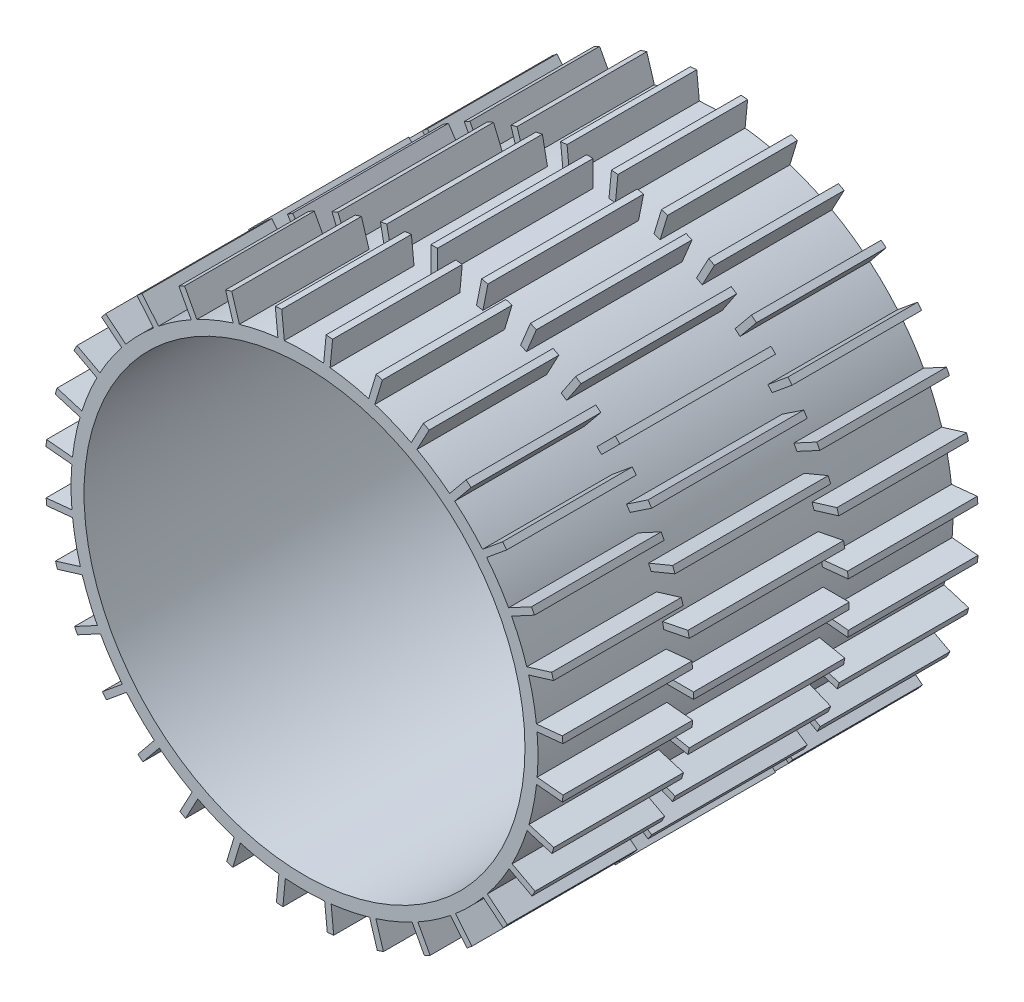
from build123d import *

# Parameters (mm, degrees)
BOSS_EXTRUDE1_DEPTH      = 38.1
BOSS_EXTRUDE1_DEPTH_BACK = 38.1
SKETCH1_R                = 107.95
SKETCH1_7_R              = 107.95
BOSS_EXTRUDE3_DEPTH      = 101.6
CUT_EXTRUDE1_DEPTH       = 38.1


with BuildPart() as part:
    # Sketch1 → Boss-Extrude1 (new, two sides: drawn at the far end of the back side and taken through both)
    with BuildSketch(Plane.XY.offset(-BOSS_EXTRUDE1_DEPTH_BACK)):
        with BuildLine():
            Line((-1.5875, 127), (-1.5875, 114.288975163))
            ThreePointArc((-1.5875, 114.288975163), (-11.20335914, 113.749614259), (-20.739676335, 112.402650438))
            Line((-20.739676335, 112.402650438), (-23.219474263, 124.869436497))
            Line((-23.219474263, 124.869436497), (-26.333467529, 124.250024725))
            Line((-26.333467529, 124.250024725), (-23.8536696, 111.783238666))
            ThreePointArc((-23.8536696, 111.783238666), (-33.17953861, 109.378280374), (-42.269838539, 106.196754893))
            Line((-42.269838539, 106.196754893), (-47.134137153, 117.940210578))
            Line((-47.134137153, 117.940210578), (-50.067454668, 116.72519068))
            Line((-50.067454668, 116.72519068), (-45.203156055, 104.981734996))
            ThreePointArc((-45.203156055, 104.981734996), (-53.880647019, 100.803600515), (-62.175594553, 95.909777614))
            Line((-62.175594553, 95.909777614), (-69.237461584, 106.478608507))
            Line((-69.237461584, 106.478608507), (-71.877377603, 104.714673018))
            Line((-71.877377603, 104.714673018), (-64.815510572, 94.145842124))
            ThreePointArc((-64.815510572, 94.145842124), (-72.51115238, 88.355094819), (-79.691977337, 81.937041368))
            Line((-79.691977337, 81.937041368), (-88.680029196, 90.925093226))
            Line((-88.680029196, 90.925093226), (-90.925093226, 88.680029196))
            Line((-90.925093226, 88.680029196), (-81.937041368, 79.691977337))
            ThreePointArc((-81.937041368, 79.691977337), (-88.355094819, 72.51115238), (-94.145842124, 64.815510572))
            Line((-94.145842124, 64.815510572), (-104.714673018, 71.877377603))
            Line((-104.714673018, 71.877377603), (-106.478608507, 69.237461584))
            Line((-106.478608507, 69.237461584), (-95.909777614, 62.175594553))
            ThreePointArc((-95.909777614, 62.175594553), (-100.803600515, 53.880647019), (-104.981734996, 45.203156055))
            Line((-104.981734996, 45.203156055), (-116.72519068, 50.067454668))
            Line((-116.72519068, 50.067454668), (-117.940210578, 47.134137153))
            Line((-117.940210578, 47.134137153), (-106.196754893, 42.269838539))
            ThreePointArc((-106.196754893, 42.269838539), (-109.378280374, 33.17953861), (-111.783238666, 23.8536696))
            Line((-111.783238666, 23.8536696), (-124.250024725, 26.333467529))
            Line((-124.250024725, 26.333467529), (-124.869436497, 23.219474263))
            Line((-124.869436497, 23.219474263), (-112.402650438, 20.739676335))
            ThreePointArc((-112.402650438, 20.739676335), (-113.749614259, 11.20335914), (-114.288975163, 1.5875))
            Line((-114.288975163, 1.5875), (-127, 1.5875))
            Line((-127, 1.5875), (-127, -1.5875))
            Line((-127, -1.5875), (-114.288975163, -1.5875))
            ThreePointArc((-114.288975163, -1.5875), (-113.749614259, -11.20335914), (-112.402650438, -20.739676335))
            Line((-112.402650438, -20.739676335), (-124.869436497, -23.219474263))
            Line((-124.869436497, -23.219474263), (-124.250024725, -26.333467529))
            Line((-124.250024725, -26.333467529), (-111.783238666, -23.8536696))
            ThreePointArc((-111.783238666, -23.8536696), (-109.378280374, -33.17953861), (-106.196754893, -42.269838539))
            Line((-106.196754893, -42.269838539), (-117.940210578, -47.134137153))
            Line((-117.940210578, -47.134137153), (-116.72519068, -50.067454668))
            Line((-116.72519068, -50.067454668), (-104.981734996, -45.203156055))
            ThreePointArc((-104.981734996, -45.203156055), (-100.803600515, -53.880647019), (-95.909777614, -62.175594553))
            Line((-95.909777614, -62.175594553), (-106.478608507, -69.237461584))
            Line((-106.478608507, -69.237461584), (-104.714673018, -71.877377603))
            Line((-104.714673018, -71.877377603), (-94.145842124, -64.815510572))
            ThreePointArc((-94.145842124, -64.815510572), (-88.355094819, -72.51115238), (-81.937041368, -79.691977337))
            Line((-81.937041368, -79.691977337), (-90.925093226, -88.680029196))
            Line((-90.925093226, -88.680029196), (-88.680029196, -90.925093226))
            Line((-88.680029196, -90.925093226), (-79.691977337, -81.937041368))
            ThreePointArc((-79.691977337, -81.937041368), (-72.51115238, -88.355094819), (-64.815510572, -94.145842124))
            Line((-64.815510572, -94.145842124), (-71.877377603, -104.714673018))
            Line((-71.877377603, -104.714673018), (-69.237461584, -106.478608507))
            Line((-69.237461584, -106.478608507), (-62.175594553, -95.909777614))
            ThreePointArc((-62.175594553, -95.909777614), (-53.880647019, -100.803600515), (-45.203156055, -104.981734996))
            Line((-45.203156055, -104.981734996), (-50.067454668, -116.72519068))
            Line((-50.067454668, -116.72519068), (-47.134137153, -117.940210578))
            Line((-47.134137153, -117.940210578), (-42.269838539, -106.196754893))
            ThreePointArc((-42.269838539, -106.196754893), (-33.17953861, -109.378280374), (-23.8536696, -111.783238666))
            Line((-23.8536696, -111.783238666), (-26.333467529, -124.250024725))
            Line((-26.333467529, -124.250024725), (-23.219474263, -124.869436497))
            Line((-23.219474263, -124.869436497), (-20.739676335, -112.402650438))
            ThreePointArc((-20.739676335, -112.402650438), (-11.20335914, -113.749614259), (-1.5875, -114.288975163))
            Line((-1.5875, -114.288975163), (-1.5875, -127))
            Line((-1.5875, -127), (1.5875, -127))
            Line((1.5875, -127), (1.5875, -114.288975163))
            ThreePointArc((1.5875, -114.288975163), (11.20335914, -113.749614259), (20.739676335, -112.402650438))
            Line((20.739676335, -112.402650438), (23.219474263, -124.869436497))
            Line((23.219474263, -124.869436497), (26.333467529, -124.250024725))
            Line((26.333467529, -124.250024725), (23.8536696, -111.783238666))
            ThreePointArc((23.8536696, -111.783238666), (33.17953861, -109.378280374), (42.269838539, -106.196754893))
            Line((42.269838539, -106.196754893), (47.134137153, -117.940210578))
            Line((47.134137153, -117.940210578), (50.067454668, -116.72519068))
            Line((50.067454668, -116.72519068), (45.203156055, -104.981734996))
            ThreePointArc((45.203156055, -104.981734996), (53.880647019, -100.803600515), (62.175594553, -95.909777614))
            Line((62.175594553, -95.909777614), (69.237461584, -106.478608507))
            Line((69.237461584, -106.478608507), (71.877377603, -104.714673018))
            Line((71.877377603, -104.714673018), (64.815510572, -94.145842124))
            ThreePointArc((64.815510572, -94.145842124), (72.51115238, -88.355094819), (79.691977337, -81.937041368))
            Line((79.691977337, -81.937041368), (88.680029196, -90.925093226))
            Line((88.680029196, -90.925093226), (90.925093226, -88.680029196))
            Line((90.925093226, -88.680029196), (81.937041368, -79.691977337))
            ThreePointArc((81.937041368, -79.691977337), (88.355094819, -72.51115238), (94.145842124, -64.815510572))
            Line((94.145842124, -64.815510572), (104.714673018, -71.877377603))
            Line((104.714673018, -71.877377603), (106.478608507, -69.237461584))
            Line((106.478608507, -69.237461584), (95.909777614, -62.175594553))
            ThreePointArc((95.909777614, -62.175594553), (100.803600515, -53.880647019), (104.981734996, -45.203156055))
            Line((104.981734996, -45.203156055), (116.72519068, -50.067454668))
            Line((116.72519068, -50.067454668), (117.940210578, -47.134137153))
            Line((117.940210578, -47.134137153), (106.196754893, -42.269838539))
            ThreePointArc((106.196754893, -42.269838539), (109.378280374, -33.17953861), (111.783238666, -23.8536696))
            Line((111.783238666, -23.8536696), (124.250024725, -26.333467529))
            Line((124.250024725, -26.333467529), (124.869436497, -23.219474263))
            Line((124.869436497, -23.219474263), (112.402650438, -20.739676335))
            ThreePointArc((112.402650438, -20.739676335), (113.749614259, -11.20335914), (114.288975163, -1.5875))
            Line((114.288975163, -1.5875), (127, -1.5875))
            Line((127, -1.5875), (127, 1.5875))
            Line((127, 1.5875), (114.288975163, 1.5875))
            ThreePointArc((114.288975163, 1.5875), (113.749614259, 11.20335914), (112.402650438, 20.739676335))
            Line((112.402650438, 20.739676335), (124.869436497, 23.219474263))
            Line((124.869436497, 23.219474263), (124.250024725, 26.333467529))
            Line((124.250024725, 26.333467529), (111.783238666, 23.8536696))
            ThreePointArc((111.783238666, 23.8536696), (109.378280374, 33.17953861), (106.196754893, 42.269838539))
            Line((106.196754893, 42.269838539), (117.940210578, 47.134137153))
            Line((117.940210578, 47.134137153), (116.72519068, 50.067454668))
            Line((116.72519068, 50.067454668), (104.981734996, 45.203156055))
            ThreePointArc((104.981734996, 45.203156055), (100.803600515, 53.880647019), (95.909777614, 62.175594553))
            Line((95.909777614, 62.175594553), (106.478608507, 69.237461584))
            Line((106.478608507, 69.237461584), (104.714673018, 71.877377603))
            Line((104.714673018, 71.877377603), (94.145842124, 64.815510572))
            ThreePointArc((94.145842124, 64.815510572), (88.355094819, 72.51115238), (81.937041368, 79.691977337))
            Line((81.937041368, 79.691977337), (90.925093226, 88.680029196))
            Line((90.925093226, 88.680029196), (88.680029196, 90.925093226))
            Line((88.680029196, 90.925093226), (79.691977337, 81.937041368))
            ThreePointArc((79.691977337, 81.937041368), (72.51115238, 88.355094819), (64.815510572, 94.145842124))
            Line((64.815510572, 94.145842124), (71.877377603, 104.714673018))
            Line((71.877377603, 104.714673018), (69.237461584, 106.478608507))
            Line((69.237461584, 106.478608507), (62.175594553, 95.909777614))
            ThreePointArc((62.175594553, 95.909777614), (53.880647019, 100.803600515), (45.203156055, 104.981734996))
            Line((45.203156055, 104.981734996), (50.067454668, 116.72519068))
            Line((50.067454668, 116.72519068), (47.134137153, 117.940210578))
            Line((47.134137153, 117.940210578), (42.269838539, 106.196754893))
            ThreePointArc((42.269838539, 106.196754893), (33.17953861, 109.378280374), (23.8536696, 111.783238666))
            Line((23.8536696, 111.783238666), (26.333467529, 124.250024725))
            Line((26.333467529, 124.250024725), (23.219474263, 124.869436497))
            Line((23.219474263, 124.869436497), (20.739676335, 112.402650438))
            ThreePointArc((20.739676335, 112.402650438), (11.20335914, 113.749614259), (1.5875, 114.288975163))
            Line((1.5875, 114.288975163), (1.5875, 127))
            Line((1.5875, 127), (-1.5875, 127))
        make_face()
        Circle(SKETCH1_R, mode=Mode.SUBTRACT)
    extrude(amount=BOSS_EXTRUDE1_DEPTH + BOSS_EXTRUDE1_DEPTH_BACK)

    # Sketch1<7> → Boss-Extrude3 (add, symmetric)
    with BuildSketch(Plane.XY):
        with BuildLine():
            Line((-9.870878362, 113.872980818), (-11.144371302, 126.520050366))
            Line((-11.144371302, 126.520050366), (-14.303396347, 126.20195327))
            Line((-14.303396347, 126.20195327), (-13.029903408, 113.554883722))
            ThreePointArc((-13.029903408, 113.554883722), (-22.543343004, 112.054842315), (-31.896728699, 109.759230584))
            Line((-31.896728699, 109.759230584), (-35.6130727, 121.914844089))
            Line((-35.6130727, 121.914844089), (-38.6493403, 120.986563926))
            Line((-38.6493403, 120.986563926), (-34.932996299, 108.830950421))
            ThreePointArc((-34.932996299, 108.830950421), (-43.97099426, 105.503751894), (-52.69680564, 101.427494672))
            Line((-52.69680564, 101.427494672), (-58.713183686, 112.624518724))
            Line((-58.713183686, 112.624518724), (-61.510011779, 111.12172878))
            Line((-61.510011779, 111.12172878), (-55.493633734, 99.924704728))
            ThreePointArc((-55.493633734, 99.924704728), (-63.708864866, 94.898211456), (-71.471773893, 89.19795702))
            Line((-71.471773893, 89.19795702), (-79.556979949, 99.006096265))
            Line((-79.556979949, 99.006096265), (-82.006888001, 96.986547916))
            Line((-82.006888001, 96.986547916), (-73.921681945, 87.178408671))
            ThreePointArc((-73.921681945, 87.178408671), (-80.998439524, 80.64578597), (-87.500121957, 73.540591904))
            Line((-87.500121957, 73.540591904), (-97.343446089, 81.58292505))
            Line((-97.343446089, 81.58292505), (-99.352285508, 79.124228405))
            Line((-99.352285508, 79.124228405), (-89.508961375, 71.081895259))
            ThreePointArc((-89.508961375, 71.081895259), (-95.175289575, 63.294188157), (-100.165889404, 55.057103083))
            Line((-100.165889404, 55.057103083), (-111.389058187, 61.024567777))
            Line((-111.389058187, 61.024567777), (-112.879630399, 58.22120917))
            Line((-112.879630399, 58.22120917), (-101.656461616, 52.253744475))
            ThreePointArc((-101.656461616, 52.253744475), (-105.694606622, 43.510230188), (-108.982337896, 34.457800666))
            Line((-108.982337896, 34.457800666), (-121.154051247, 38.121070588))
            Line((-121.154051247, 38.121070588), (-122.069074398, 35.080781518))
            Line((-122.069074398, 35.080781518), (-109.897361047, 31.417511595))
            ThreePointArc((-109.897361047, 31.417511595), (-112.152139211, 22.054198474), (-113.61065626, 12.534304294))
            Line((-113.61065626, 12.534304294), (-126.263162061, 13.752602035))
            Line((-126.263162061, 13.752602035), (-126.567472325, 10.592219105))
            Line((-126.567472325, 10.592219105), (-113.914966524, 9.373921364))
            ThreePointArc((-113.914966524, 9.373921364), (-114.299727986, -0.249363719), (-113.872980818, -9.870878362))
            Line((-113.872980818, -9.870878362), (-126.520050366, -11.144371302))
            Line((-126.520050366, -11.144371302), (-126.20195327, -14.303396347))
            Line((-126.20195327, -14.303396347), (-113.554883722, -13.029903408))
            ThreePointArc((-113.554883722, -13.029903408), (-112.054842315, -22.543343004), (-109.759230584, -31.896728699))
            Line((-109.759230584, -31.896728699), (-121.914844089, -35.6130727))
            Line((-121.914844089, -35.6130727), (-120.986563926, -38.6493403))
            Line((-120.986563926, -38.6493403), (-108.830950421, -34.932996299))
            ThreePointArc((-108.830950421, -34.932996299), (-105.503751894, -43.97099426), (-101.427494672, -52.69680564))
            Line((-101.427494672, -52.69680564), (-112.624518724, -58.713183686))
            Line((-112.624518724, -58.713183686), (-111.12172878, -61.510011779))
            Line((-111.12172878, -61.510011779), (-99.924704728, -55.493633734))
            ThreePointArc((-99.924704728, -55.493633734), (-94.898211456, -63.708864866), (-89.19795702, -71.471773893))
            Line((-89.19795702, -71.471773893), (-99.006096265, -79.556979949))
            Line((-99.006096265, -79.556979949), (-96.986547916, -82.006888001))
            Line((-96.986547916, -82.006888001), (-87.178408671, -73.921681945))
            ThreePointArc((-87.178408671, -73.921681945), (-80.64578597, -80.998439524), (-73.540591904, -87.500121957))
            Line((-73.540591904, -87.500121957), (-81.58292505, -97.343446089))
            Line((-81.58292505, -97.343446089), (-79.124228405, -99.352285508))
            Line((-79.124228405, -99.352285508), (-71.081895259, -89.508961375))
            ThreePointArc((-71.081895259, -89.508961375), (-63.294188157, -95.175289575), (-55.057103083, -100.165889404))
            Line((-55.057103083, -100.165889404), (-61.024567777, -111.389058187))
            Line((-61.024567777, -111.389058187), (-58.22120917, -112.879630399))
            Line((-58.22120917, -112.879630399), (-52.253744475, -101.656461616))
            ThreePointArc((-52.253744475, -101.656461616), (-43.510230188, -105.694606622), (-34.457800666, -108.982337896))
            Line((-34.457800666, -108.982337896), (-38.121070588, -121.154051247))
            Line((-38.121070588, -121.154051247), (-35.080781518, -122.069074398))
            Line((-35.080781518, -122.069074398), (-31.417511595, -109.897361047))
            ThreePointArc((-31.417511595, -109.897361047), (-22.054198474, -112.152139211), (-12.534304294, -113.61065626))
            Line((-12.534304294, -113.61065626), (-13.752602035, -126.263162061))
            Line((-13.752602035, -126.263162061), (-10.592219105, -126.567472325))
            Line((-10.592219105, -126.567472325), (-9.373921364, -113.914966524))
            ThreePointArc((-9.373921364, -113.914966524), (0.249363719, -114.299727986), (9.870878362, -113.872980818))
            Line((9.870878362, -113.872980818), (11.144371302, -126.520050366))
            Line((11.144371302, -126.520050366), (14.303396347, -126.20195327))
            Line((14.303396347, -126.20195327), (13.029903408, -113.554883722))
            ThreePointArc((13.029903408, -113.554883722), (22.543343004, -112.054842315), (31.896728699, -109.759230584))
            Line((31.896728699, -109.759230584), (35.6130727, -121.914844089))
            Line((35.6130727, -121.914844089), (38.6493403, -120.986563926))
            Line((38.6493403, -120.986563926), (34.932996299, -108.830950421))
            ThreePointArc((34.932996299, -108.830950421), (43.97099426, -105.503751894), (52.69680564, -101.427494672))
            Line((52.69680564, -101.427494672), (58.713183686, -112.624518724))
            Line((58.713183686, -112.624518724), (61.510011779, -111.12172878))
            Line((61.510011779, -111.12172878), (55.493633734, -99.924704728))
            ThreePointArc((55.493633734, -99.924704728), (63.708864866, -94.898211456), (71.471773893, -89.19795702))
            Line((71.471773893, -89.19795702), (79.556979949, -99.006096265))
            Line((79.556979949, -99.006096265), (82.006888001, -96.986547916))
            Line((82.006888001, -96.986547916), (73.921681945, -87.178408671))
            ThreePointArc((73.921681945, -87.178408671), (80.998439524, -80.64578597), (87.500121957, -73.540591904))
            Line((87.500121957, -73.540591904), (97.343446089, -81.58292505))
            Line((97.343446089, -81.58292505), (99.352285508, -79.124228405))
            Line((99.352285508, -79.124228405), (89.508961375, -71.081895259))
            ThreePointArc((89.508961375, -71.081895259), (95.175289575, -63.294188157), (100.165889404, -55.057103083))
            Line((100.165889404, -55.057103083), (111.389058187, -61.024567777))
            Line((111.389058187, -61.024567777), (112.879630399, -58.22120917))
            Line((112.879630399, -58.22120917), (101.656461616, -52.253744475))
            ThreePointArc((101.656461616, -52.253744475), (105.694606622, -43.510230188), (108.982337896, -34.457800666))
            Line((108.982337896, -34.457800666), (121.154051247, -38.121070588))
            Line((121.154051247, -38.121070588), (122.069074398, -35.080781518))
            Line((122.069074398, -35.080781518), (109.897361047, -31.417511595))
            ThreePointArc((109.897361047, -31.417511595), (112.152139211, -22.054198474), (113.61065626, -12.534304294))
            Line((113.61065626, -12.534304294), (126.263162061, -13.752602035))
            Line((126.263162061, -13.752602035), (126.567472325, -10.592219105))
            Line((126.567472325, -10.592219105), (113.914966524, -9.373921364))
            ThreePointArc((113.914966524, -9.373921364), (114.299727986, 0.249363719), (113.872980818, 9.870878362))
            Line((113.872980818, 9.870878362), (126.520050366, 11.144371302))
            Line((126.520050366, 11.144371302), (126.20195327, 14.303396347))
            Line((126.20195327, 14.303396347), (113.554883722, 13.029903408))
            ThreePointArc((113.554883722, 13.029903408), (112.054842315, 22.543343004), (109.759230584, 31.896728699))
            Line((109.759230584, 31.896728699), (121.914844089, 35.6130727))
            Line((121.914844089, 35.6130727), (120.986563926, 38.6493403))
            Line((120.986563926, 38.6493403), (108.830950421, 34.932996299))
            ThreePointArc((108.830950421, 34.932996299), (105.503751894, 43.97099426), (101.427494672, 52.69680564))
            Line((101.427494672, 52.69680564), (112.624518724, 58.713183686))
            Line((112.624518724, 58.713183686), (111.12172878, 61.510011779))
            Line((111.12172878, 61.510011779), (99.924704728, 55.493633734))
            ThreePointArc((99.924704728, 55.493633734), (94.898211456, 63.708864866), (89.19795702, 71.471773893))
            Line((89.19795702, 71.471773893), (99.006096265, 79.556979949))
            Line((99.006096265, 79.556979949), (96.986547916, 82.006888001))
            Line((96.986547916, 82.006888001), (87.178408671, 73.921681945))
            ThreePointArc((87.178408671, 73.921681945), (80.64578597, 80.998439524), (73.540591904, 87.500121957))
            Line((73.540591904, 87.500121957), (81.58292505, 97.343446089))
            Line((81.58292505, 97.343446089), (79.124228405, 99.352285508))
            Line((79.124228405, 99.352285508), (71.081895259, 89.508961375))
            ThreePointArc((71.081895259, 89.508961375), (63.294188157, 95.175289575), (55.057103083, 100.165889404))
            Line((55.057103083, 100.165889404), (61.024567777, 111.389058187))
            Line((61.024567777, 111.389058187), (58.22120917, 112.879630399))
            Line((58.22120917, 112.879630399), (52.253744475, 101.656461616))
            ThreePointArc((52.253744475, 101.656461616), (43.510230188, 105.694606622), (34.457800666, 108.982337896))
            Line((34.457800666, 108.982337896), (38.121070588, 121.154051247))
            Line((38.121070588, 121.154051247), (35.080781518, 122.069074398))
            Line((35.080781518, 122.069074398), (31.417511595, 109.897361047))
            ThreePointArc((31.417511595, 109.897361047), (22.054198474, 112.152139211), (12.534304294, 113.61065626))
            Line((12.534304294, 113.61065626), (13.752602035, 126.263162061))
            Line((13.752602035, 126.263162061), (10.592219105, 126.567472325))
            Line((10.592219105, 126.567472325), (9.373921364, 113.914966524))
            ThreePointArc((9.373921364, 113.914966524), (-0.249363719, 114.299727986), (-9.870878362, 113.872980818))
        make_face()
        Circle(SKETCH1_7_R, mode=Mode.SUBTRACT)
    extrude(amount=BOSS_EXTRUDE3_DEPTH, both=True)

    # Sketch1<11> → Cut-Extrude1 (cut, symmetric)
    with BuildSketch(Plane.XY):
        with BuildLine():
            Line((10.592219105, 126.567472325), (9.373921364, 113.914966524))
            ThreePointArc((9.373921364, 113.914966524), (10.955169513, 113.773785473), (12.534304294, 113.61065626))
            Line((12.534304294, 113.61065626), (13.752602035, 126.263162061))
            Line((13.752602035, 126.263162061), (10.592219105, 126.567472325))
        make_face()
        with BuildLine():
            ThreePointArc((-13.029903408, 113.554883722), (-11.451495442, 113.724901636), (-9.870878362, 113.872980818))
            Line((-9.870878362, 113.872980818), (-11.144371302, 126.520050366))
            Line((-11.144371302, 126.520050366), (-14.303396347, 126.20195327))
            Line((-14.303396347, 126.20195327), (-13.029903408, 113.554883722))
        make_face()
        with BuildLine():
            Line((35.080781518, 122.069074398), (31.417511595, 109.897361047))
            ThreePointArc((31.417511595, 109.897361047), (32.940833448, 109.45040654), (34.457800666, 108.982337896))
            Line((34.457800666, 108.982337896), (38.121070588, 121.154051247))
            Line((38.121070588, 121.154051247), (35.080781518, 122.069074398))
        make_face()
        with BuildLine():
            ThreePointArc((-34.932996299, 108.830950421), (-33.41808585, 109.305633607), (-31.896728699, 109.759230584))
            Line((-31.896728699, 109.759230584), (-35.6130727, 121.914844089))
            Line((-35.6130727, 121.914844089), (-38.6493403, 120.986563926))
            Line((-38.6493403, 120.986563926), (-34.932996299, 108.830950421))
        make_face()
        with BuildLine():
            Line((58.22120917, 112.879630399), (52.253744475, 101.656461616))
            ThreePointArc((52.253744475, 101.656461616), (53.660599626, 100.920909864), (55.057103083, 100.165889404))
            Line((55.057103083, 100.165889404), (61.024567777, 111.389058187))
            Line((61.024567777, 111.389058187), (58.22120917, 112.879630399))
        make_face()
        with BuildLine():
            ThreePointArc((-55.493633734, 99.924704728), (-54.100437959, 100.685811377), (-52.69680564, 101.427494672))
            Line((-52.69680564, 101.427494672), (-58.713183686, 112.624518724))
            Line((-58.713183686, 112.624518724), (-61.510011779, 111.12172878))
            Line((-61.510011779, 111.12172878), (-55.493633734, 99.924704728))
        make_face()
        with BuildLine():
            Line((79.124228405, 99.352285508), (71.081895259, 89.508961375))
            ThreePointArc((71.081895259, 89.508961375), (72.318219055, 88.513079219), (73.540591904, 87.500121957))
            Line((73.540591904, 87.500121957), (81.58292505, 97.343446089))
            Line((81.58292505, 97.343446089), (79.124228405, 99.352285508))
        make_face()
        with BuildLine():
            ThreePointArc((-73.921681945, 87.178408671), (-72.703740578, 88.196689881), (-71.471773893, 89.19795702))
            Line((-71.471773893, 89.19795702), (-79.556979949, 99.006096265))
            Line((-79.556979949, 99.006096265), (-82.006888001, 96.986547916))
            Line((-82.006888001, 96.986547916), (-73.921681945, 87.178408671))
        make_face()
        with BuildLine():
            Line((96.986547916, 82.006888001), (87.178408671, 73.921681945))
            ThreePointArc((87.178408671, 73.921681945), (88.196689881, 72.703740578), (89.19795702, 71.471773893))
            Line((89.19795702, 71.471773893), (99.006096265, 79.556979949))
            Line((99.006096265, 79.556979949), (96.986547916, 82.006888001))
        make_face()
        with BuildLine():
            ThreePointArc((-89.508961375, 71.081895259), (-88.513079219, 72.318219055), (-87.500121957, 73.540591904))
            Line((-87.500121957, 73.540591904), (-97.343446089, 81.58292505))
            Line((-97.343446089, 81.58292505), (-99.352285508, 79.124228405))
            Line((-99.352285508, 79.124228405), (-89.508961375, 71.081895259))
        make_face()
        with BuildLine():
            Line((111.12172878, 61.510011779), (99.924704728, 55.493633734))
            ThreePointArc((99.924704728, 55.493633734), (100.685811377, 54.100437959), (101.427494672, 52.69680564))
            Line((101.427494672, 52.69680564), (112.624518724, 58.713183686))
            Line((112.624518724, 58.713183686), (111.12172878, 61.510011779))
        make_face()
        with BuildLine():
            ThreePointArc((-101.656461616, 52.253744475), (-100.920909864, 53.660599626), (-100.165889404, 55.057103083))
            Line((-100.165889404, 55.057103083), (-111.389058187, 61.024567777))
            Line((-111.389058187, 61.024567777), (-112.879630399, 58.22120917))
            Line((-112.879630399, 58.22120917), (-101.656461616, 52.253744475))
        make_face()
        with BuildLine():
            Line((120.986563926, 38.6493403), (108.830950421, 34.932996299))
            ThreePointArc((108.830950421, 34.932996299), (109.305633607, 33.41808585), (109.759230584, 31.896728699))
            Line((109.759230584, 31.896728699), (121.914844089, 35.6130727))
            Line((121.914844089, 35.6130727), (120.986563926, 38.6493403))
        make_face()
        with BuildLine():
            ThreePointArc((-109.897361047, 31.417511595), (-109.45040654, 32.940833448), (-108.982337896, 34.457800666))
            Line((-108.982337896, 34.457800666), (-121.154051247, 38.121070588))
            Line((-121.154051247, 38.121070588), (-122.069074398, 35.080781518))
            Line((-122.069074398, 35.080781518), (-109.897361047, 31.417511595))
        make_face()
        with BuildLine():
            Line((126.20195327, 14.303396347), (113.554883722, 13.029903408))
            ThreePointArc((113.554883722, 13.029903408), (113.724901636, 11.451495442), (113.872980818, 9.870878362))
            Line((113.872980818, 9.870878362), (126.520050366, 11.144371302))
            Line((126.520050366, 11.144371302), (126.20195327, 14.303396347))
        make_face()
        with BuildLine():
            ThreePointArc((-113.914966524, 9.373921364), (-113.773785473, 10.955169513), (-113.61065626, 12.534304294))
            Line((-113.61065626, 12.534304294), (-126.263162061, 13.752602035))
            Line((-126.263162061, 13.752602035), (-126.567472325, 10.592219105))
            Line((-126.567472325, 10.592219105), (-113.914966524, 9.373921364))
        make_face()
        with BuildLine():
            ThreePointArc((-113.554883722, -13.029903408), (-113.724901636, -11.451495442), (-113.872980818, -9.870878362))
            Line((-113.872980818, -9.870878362), (-126.520050366, -11.144371302))
            Line((-126.520050366, -11.144371302), (-126.20195327, -14.303396347))
            Line((-126.20195327, -14.303396347), (-113.554883722, -13.029903408))
        make_face()
        with BuildLine():
            Line((126.567472325, -10.592219105), (113.914966524, -9.373921364))
            ThreePointArc((113.914966524, -9.373921364), (113.773785473, -10.955169513), (113.61065626, -12.534304294))
            Line((113.61065626, -12.534304294), (126.263162061, -13.752602035))
            Line((126.263162061, -13.752602035), (126.567472325, -10.592219105))
        make_face()
        with BuildLine():
            ThreePointArc((-108.830950421, -34.932996299), (-109.305633607, -33.41808585), (-109.759230584, -31.896728699))
            Line((-109.759230584, -31.896728699), (-121.914844089, -35.6130727))
            Line((-121.914844089, -35.6130727), (-120.986563926, -38.6493403))
            Line((-120.986563926, -38.6493403), (-108.830950421, -34.932996299))
        make_face()
        with BuildLine():
            Line((122.069074398, -35.080781518), (109.897361047, -31.417511595))
            ThreePointArc((109.897361047, -31.417511595), (109.45040654, -32.940833448), (108.982337896, -34.457800666))
            Line((108.982337896, -34.457800666), (121.154051247, -38.121070588))
            Line((121.154051247, -38.121070588), (122.069074398, -35.080781518))
        make_face()
        with BuildLine():
            ThreePointArc((-99.924704728, -55.493633734), (-100.685811377, -54.100437959), (-101.427494672, -52.69680564))
            Line((-101.427494672, -52.69680564), (-112.624518724, -58.713183686))
            Line((-112.624518724, -58.713183686), (-111.12172878, -61.510011779))
            Line((-111.12172878, -61.510011779), (-99.924704728, -55.493633734))
        make_face()
        with BuildLine():
            Line((112.879630399, -58.22120917), (101.656461616, -52.253744475))
            ThreePointArc((101.656461616, -52.253744475), (100.920909864, -53.660599626), (100.165889404, -55.057103083))
            Line((100.165889404, -55.057103083), (111.389058187, -61.024567777))
            Line((111.389058187, -61.024567777), (112.879630399, -58.22120917))
        make_face()
        with BuildLine():
            ThreePointArc((-87.178408671, -73.921681945), (-88.196689881, -72.703740578), (-89.19795702, -71.471773893))
            Line((-89.19795702, -71.471773893), (-99.006096265, -79.556979949))
            Line((-99.006096265, -79.556979949), (-96.986547916, -82.006888001))
            Line((-96.986547916, -82.006888001), (-87.178408671, -73.921681945))
        make_face()
        with BuildLine():
            Line((99.352285508, -79.124228405), (89.508961375, -71.081895259))
            ThreePointArc((89.508961375, -71.081895259), (88.513079219, -72.318219055), (87.500121957, -73.540591904))
            Line((87.500121957, -73.540591904), (97.343446089, -81.58292505))
            Line((97.343446089, -81.58292505), (99.352285508, -79.124228405))
        make_face()
        with BuildLine():
            ThreePointArc((-71.081895259, -89.508961375), (-72.318219055, -88.513079219), (-73.540591904, -87.500121957))
            Line((-73.540591904, -87.500121957), (-81.58292505, -97.343446089))
            Line((-81.58292505, -97.343446089), (-79.124228405, -99.352285508))
            Line((-79.124228405, -99.352285508), (-71.081895259, -89.508961375))
        make_face()
        with BuildLine():
            Line((82.006888001, -96.986547916), (73.921681945, -87.178408671))
            ThreePointArc((73.921681945, -87.178408671), (72.703740578, -88.196689881), (71.471773893, -89.19795702))
            Line((71.471773893, -89.19795702), (79.556979949, -99.006096265))
            Line((79.556979949, -99.006096265), (82.006888001, -96.986547916))
        make_face()
        with BuildLine():
            ThreePointArc((-52.253744475, -101.656461616), (-53.660599626, -100.920909864), (-55.057103083, -100.165889404))
            Line((-55.057103083, -100.165889404), (-61.024567777, -111.389058187))
            Line((-61.024567777, -111.389058187), (-58.22120917, -112.879630399))
            Line((-58.22120917, -112.879630399), (-52.253744475, -101.656461616))
        make_face()
        with BuildLine():
            Line((61.510011779, -111.12172878), (55.493633734, -99.924704728))
            ThreePointArc((55.493633734, -99.924704728), (54.100437959, -100.685811377), (52.69680564, -101.427494672))
            Line((52.69680564, -101.427494672), (58.713183686, -112.624518724))
            Line((58.713183686, -112.624518724), (61.510011779, -111.12172878))
        make_face()
        with BuildLine():
            ThreePointArc((-31.417511595, -109.897361047), (-32.940833448, -109.45040654), (-34.457800666, -108.982337896))
            Line((-34.457800666, -108.982337896), (-38.121070588, -121.154051247))
            Line((-38.121070588, -121.154051247), (-35.080781518, -122.069074398))
            Line((-35.080781518, -122.069074398), (-31.417511595, -109.897361047))
        make_face()
        with BuildLine():
            Line((38.6493403, -120.986563926), (34.932996299, -108.830950421))
            ThreePointArc((34.932996299, -108.830950421), (33.41808585, -109.305633607), (31.896728699, -109.759230584))
            Line((31.896728699, -109.759230584), (35.6130727, -121.914844089))
            Line((35.6130727, -121.914844089), (38.6493403, -120.986563926))
        make_face()
        with BuildLine():
            ThreePointArc((-9.373921364, -113.914966524), (-10.955169513, -113.773785473), (-12.534304294, -113.61065626))
            Line((-12.534304294, -113.61065626), (-13.752602035, -126.263162061))
            Line((-13.752602035, -126.263162061), (-10.592219105, -126.567472325))
            Line((-10.592219105, -126.567472325), (-9.373921364, -113.914966524))
        make_face()
        with BuildLine():
            Line((14.303396347, -126.20195327), (13.029903408, -113.554883722))
            ThreePointArc((13.029903408, -113.554883722), (11.451495442, -113.724901636), (9.870878362, -113.872980818))
            Line((9.870878362, -113.872980818), (11.144371302, -126.520050366))
            Line((11.144371302, -126.520050366), (14.303396347, -126.20195327))
        make_face()
    extrude(amount=CUT_EXTRUDE1_DEPTH, both=True, mode=Mode.SUBTRACT)


solid = part.part
